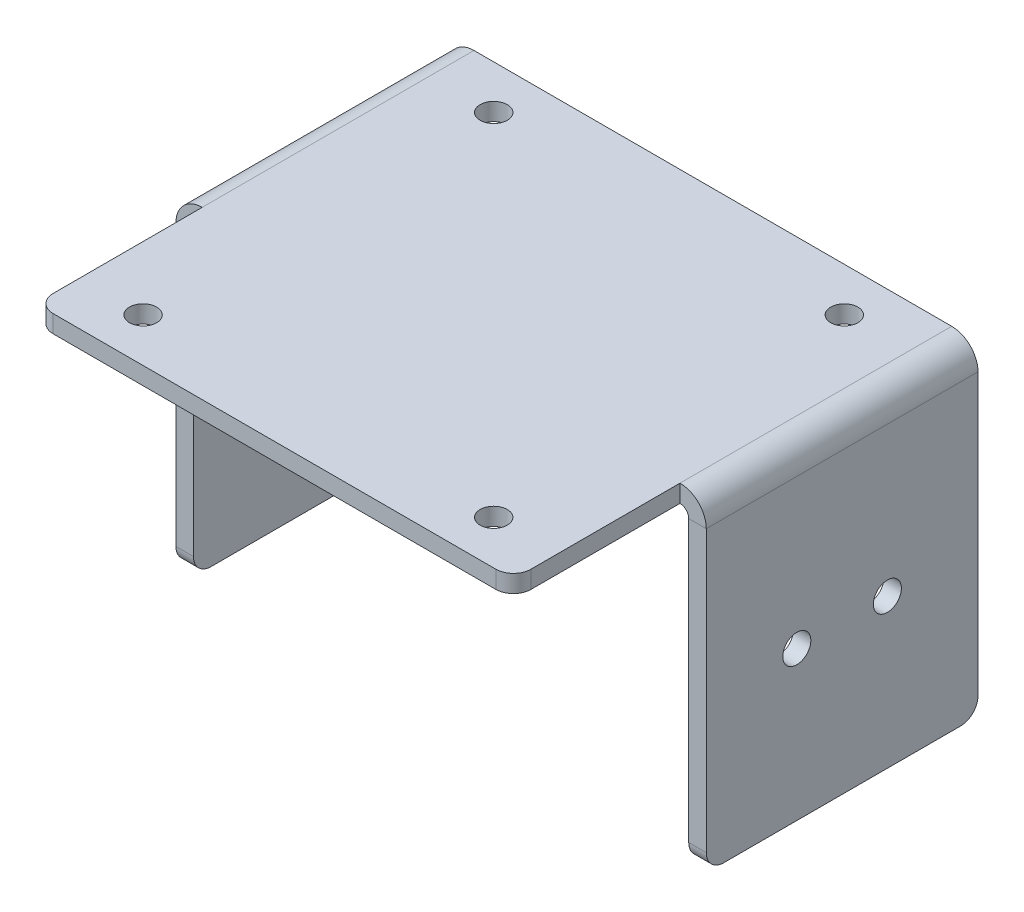
from build123d import *

# Parameters (mm, degrees)
SKETCH1_W               = 54.5
SKETCH1_H               = 50
BASE_FLANGE1_DEPTH      = 2
EDGE_FLANGE1_DEPTH      = 31
EDGE_FLANGE1_BEND_DEPTH = 31
SKETCH12_R              = 1.55
CUT_EXTRUDE1_DEPTH      = 54.935725637
SKETCH13_R              = 1.6
CUT_EXTRUDE2_DEPTH      = 76.194747157
BREAK_CORNER1_START     = -30.25
BREAK_CORNER1_DEPTH     = 60.5
BREAK_CORNER1_START_2   = -2
BREAK_CORNER1_2_DEPTH   = 2


# Read off the part's stored shape, not the designer's step: Break-Corner1
# Sheet-metal steps are written as plain solids
with BuildPart() as part:
    # Sketch1 → Base-Flange1 (new body)
    with BuildSketch(Plane(origin=(0, 0, 0), x_dir=(1, 0, 0), z_dir=(0, 1, 0))):
        Rectangle(SKETCH1_W, SKETCH1_H)
    extrude(amount=-BASE_FLANGE1_DEPTH)

    # Edge-Flange1 section (across the edge) → Edge-Flange1 (add)
    with BuildSketch(Plane(origin=(28.25, -2, -25), x_dir=(-1, 0, 0), z_dir=(0, 0, 1))):
        with BuildLine():
            Line((-2, 1), (-2, 35))
            Line((-2, 35), (0, 35))
            Line((0, 35), (0, 1))
            ThreePointArc((0, 1), (0.292893219, 0.292893219), (1, 0))
            Line((1, 0), (1, -2))
            ThreePointArc((1, -2), (-1.121320344, -1.121320344), (-2, 1))
        make_face()
    extrude(amount=EDGE_FLANGE1_DEPTH)

    # Edge-Flange1 section 2 (across the edge) → Edge-Flange1 bend (add)
    with BuildSketch(Plane(origin=(-28.25, -2, 6), x_dir=(1, 0, 0), z_dir=(0, 0, -1))):
        with BuildLine():
            Line((-2, 1), (-2, 35))
            Line((-2, 35), (0, 35))
            Line((0, 35), (0, 1))
            ThreePointArc((0, 1), (0.292893219, 0.292893219), (1, 0))
            Line((1, 0), (1, -2))
            ThreePointArc((1, -2), (-1.121320344, -1.121320344), (-2, 1))
        make_face()
    extrude(amount=EDGE_FLANGE1_BEND_DEPTH)

    # Sketch12 → Cut-Extrude1 (cut, through all)
    with BuildSketch(Plane(origin=(0, 0, 0), x_dir=(1, 0, 0), z_dir=(0, 1, 0))):
        with Locations(Location((-20, 20, 0), (0, 0, 270))):
            Circle(SKETCH12_R)
        with Locations(Location((20, 20, 0), (0, 0, 270))):
            Circle(SKETCH12_R)
        with Locations(Location((20, -20, 0), (0, 0, 270))):
            Circle(SKETCH12_R)
        with Locations(Location((-20, -20, 0), (0, 0, 270))):
            Circle(SKETCH12_R)
    extrude(amount=-CUT_EXTRUDE1_DEPTH, mode=Mode.SUBTRACT)

    # Sketch13 → Cut-Extrude2 (cut, through all)
    with BuildSketch(Plane(origin=(30.25, 0, 0), x_dir=(0, 0, -1), z_dir=(1, 0, 0))):
        with Locations(Location((14.66, -20, 0), (0, 0, 90))):
            Circle(SKETCH13_R)
        with Locations(Location((4.33, -20, 0), (0, 0, 90))):
            Circle(SKETCH13_R)
    extrude(amount=-CUT_EXTRUDE2_DEPTH, mode=Mode.SUBTRACT)

    # Break-Corner1 outline → Break-Corner1 (cut)
    with BuildSketch(Plane.YZ.offset(BREAK_CORNER1_START)):
        with BuildLine():
            ThreePointArc((-35, -25), (-36.414213562, -24.414213562), (-37, -23))
            Line((-37, -23), (-37, -25))
            Line((-37, -25), (-35, -25))
        make_face()
        with BuildLine():
            ThreePointArc((-37, 4), (-36.414213562, 5.414213562), (-35, 6))
            Line((-35, 6), (-37, 6))
            Line((-37, 6), (-37, 4))
        make_face()
    extrude(amount=BREAK_CORNER1_DEPTH, mode=Mode.SUBTRACT)

    # Break-Corner1 2 outline → Break-Corner1 2 (cut)
    with BuildSketch(Plane(origin=(0, 0, 0), x_dir=(1, 0, 0), z_dir=(0, 1, 0)).offset(BREAK_CORNER1_START_2)):
        with BuildLine():
            Line((-27.25, -25), (-25.25, -25))
            ThreePointArc((-25.25, -25), (-26.664213562, -24.414213562), (-27.25, -23))
            Line((-27.25, -23), (-27.25, -25))
        make_face()
        with BuildLine():
            ThreePointArc((27.25, -23), (26.664213562, -24.414213562), (25.25, -25))
            Line((25.25, -25), (27.25, -25))
            Line((27.25, -25), (27.25, -23))
        make_face()
    extrude(amount=BREAK_CORNER1_2_DEPTH, mode=Mode.SUBTRACT)


solid = part.part
